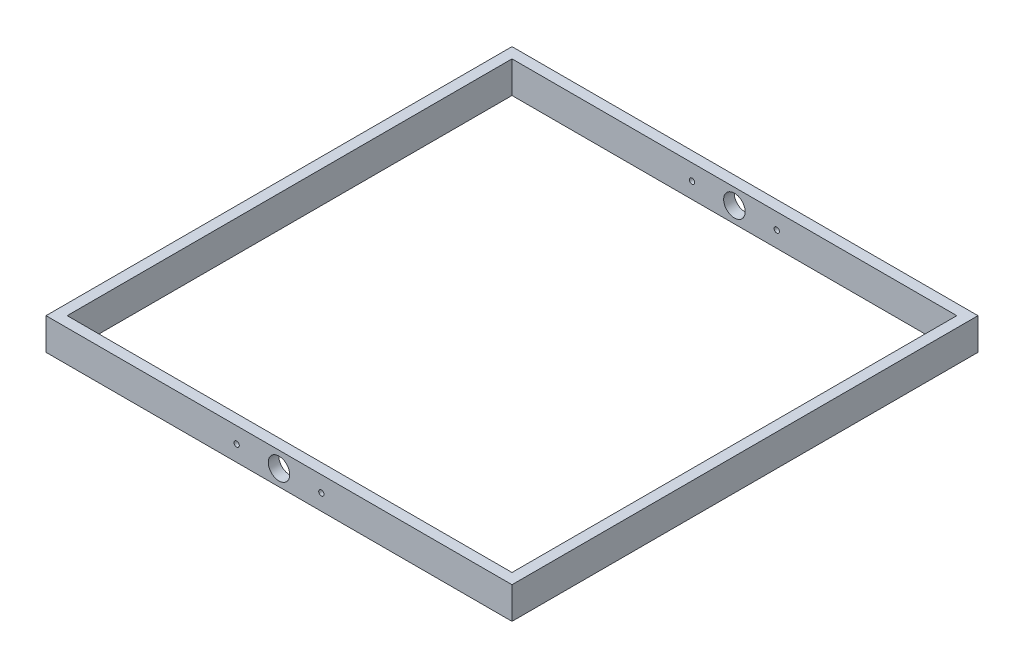
from build123d import *

# Parameters (mm, degrees)
SKETCH1_W           = 220
SKETCH1_H           = 220
BOSS_EXTRUDE1_DEPTH = 15
SKETCH2_W           = 210
SKETCH2_H           = 210
CUT_EXTRUDE1_DEPTH  = 15
SKETCH3_R           = 5.075
CUT_EXTRUDE2_DEPTH  = 247.424430607
SKETCH4_R           = 1.25
CUT_EXTRUDE3_DEPTH  = 247.424430607


with BuildPart() as part:
    # Sketch1 → Boss-Extrude1 (new body)
    with BuildSketch(Plane(origin=(0, 0, 0), x_dir=(1, 0, 0), z_dir=(0, 1, 0))):
        Rectangle(SKETCH1_W, SKETCH1_H)
    extrude(amount=BOSS_EXTRUDE1_DEPTH)

    # Sketch2 → Cut-Extrude1 (cut)
    with BuildSketch(Plane(origin=(0, 15, 0), x_dir=(1, 0, 0), z_dir=(0, 1, 0))):
        Rectangle(SKETCH2_W, SKETCH2_H)
    extrude(amount=-CUT_EXTRUDE1_DEPTH, mode=Mode.SUBTRACT)

    # Sketch3 → Cut-Extrude2 (cut, through all)
    with BuildSketch(Plane.XY.offset(110)):
        with Locations((0, 7.5)):
            Circle(SKETCH3_R)
    extrude(amount=-CUT_EXTRUDE2_DEPTH, mode=Mode.SUBTRACT)

    # Sketch4 → Cut-Extrude3 (cut, through all)
    with BuildSketch(Plane.XY.offset(110)):
        with Locations((-20, 7.5)):
            Circle(SKETCH4_R)
        with Locations((20, 7.5)):
            Circle(SKETCH4_R)
    extrude(amount=-CUT_EXTRUDE3_DEPTH, mode=Mode.SUBTRACT)


solid = part.part
